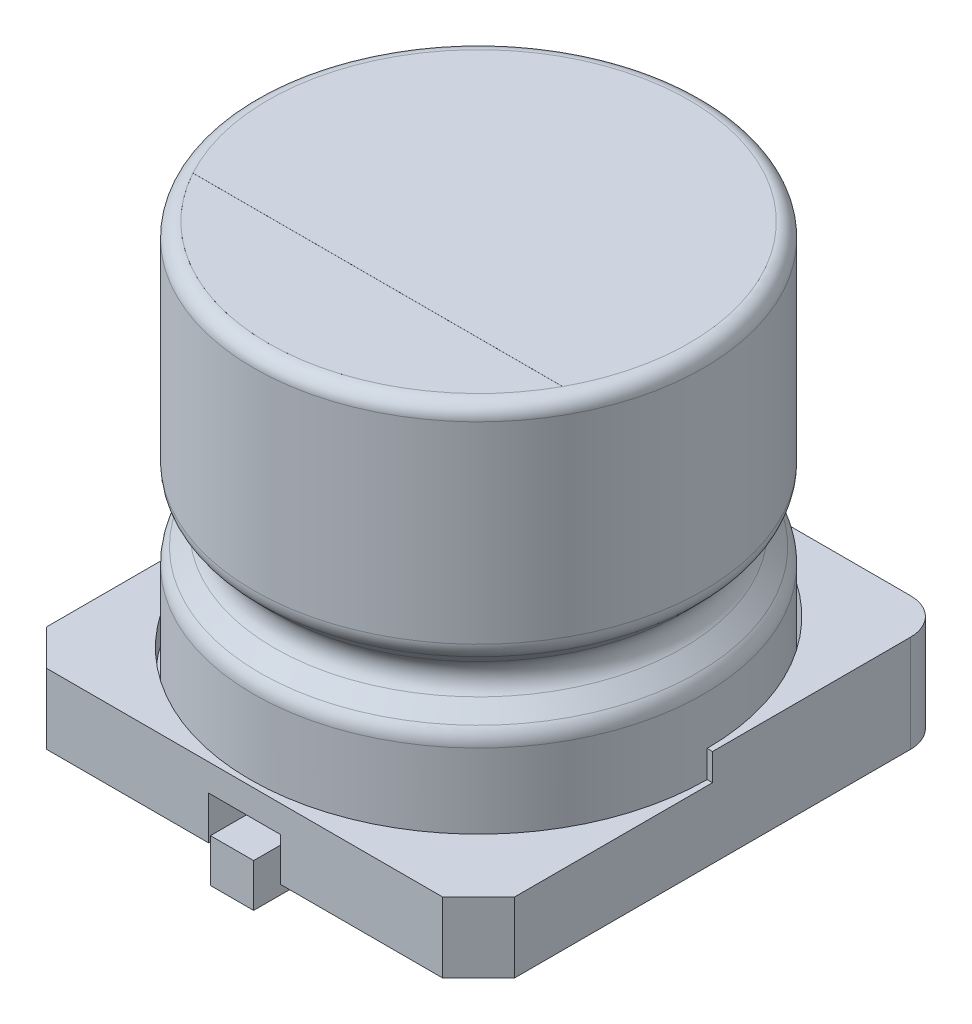
from build123d import *

# Parameters (mm, degrees)
EXTRUDE1_DEPTH     = 1.2
EXTRUDE2_START     = 1.5
SKETCH3_R          = 6.35
EXTRUDE2_DEPTH     = 1.5
EXTRUDE3_DEPTH     = 0.75
SKETCH5_R          = 0.75
EXTRUDE4_DEPTH     = 0.3
SKETCH7_W          = 1.2
SKETCH7_H          = 1.2
SCALE1_SCALE       = 0.5
CUT_EXTRUDE1_DEPTH = 0.001


with BuildPart() as part:
    # Sketch1 → Revolve1 (revolve)
    with BuildSketch(Plane.XY):
        with BuildLine():
            Line((0, 0), (-6.25, 0))
            Line((-6.25, 0), (-6.25, 2.751471863))
            ThreePointArc((-6.25, 2.751471863), (-6.20432772, 2.981081922), (-6.074264069, 3.175735931))
            Line((-6.074264069, 3.175735931), (-5.674264069, 3.575735931))
            ThreePointArc((-5.674264069, 3.575735931), (-5.498528137, 4), (-5.674264069, 4.424264069))
            Line((-5.674264069, 4.424264069), (-6.074264069, 4.824264069))
            ThreePointArc((-6.074264069, 4.824264069), (-6.20432772, 5.018918078), (-6.25, 5.248528137))
            Line((-6.25, 5.248528137), (-6.25, 10.6))
            ThreePointArc((-6.25, 10.6), (-6.132842712, 10.882842712), (-5.85, 11))
            Line((-5.85, 11), (0, 11))
            Line((0, 11), (0, 0))
        make_face()
    revolve(axis=Axis((0, 11, 0), (0, -1, 0)))

    # Sketch2 → Extrude1 (add)
    with BuildSketch(Plane.XZ):
        with BuildLine():
            Line((-6.5, 5.5), (-5.5, 6.5))
            Line((-5.5, 6.5), (-1, 6.5))
            Line((-1, 6.5), (-1, 1.6))
            Line((-1, 1.6), (1, 1.6))
            Line((1, 1.6), (1, 6.5))
            Line((1, 6.5), (5.5, 6.5))
            Line((5.5, 6.5), (6.5, 5.5))
            Line((6.5, 5.5), (6.5, -5.5))
            ThreePointArc((6.5, -5.5), (6.207106781, -6.207106781), (5.5, -6.5))
            Line((5.5, -6.5), (1, -6.5))
            Line((1, -6.5), (1, -1.6))
            Line((1, -1.6), (-1, -1.6))
            Line((-1, -1.6), (-1, -6.5))
            Line((-1, -6.5), (-5.5, -6.5))
            ThreePointArc((-5.5, -6.5), (-6.207106781, -6.207106781), (-6.5, -5.5))
            Line((-6.5, -5.5), (-6.5, 5.5))
        make_face()
    extrude(amount=EXTRUDE1_DEPTH)

    # Sketch3 → Extrude2 (add)
    with BuildSketch(Plane(origin=(0, 0, 0), x_dir=(1, 0, 0), z_dir=(0, 1, 0)).offset(EXTRUDE2_START)):
        with BuildLine():
            Line((5.5, -6.5), (-5.5, -6.5))
            Line((-5.5, -6.5), (-6.5, -5.5))
            Line((-6.5, -5.5), (-6.5, 5.5))
            ThreePointArc((-6.5, 5.5), (-6.207106781, 6.207106781), (-5.5, 6.5))
            Line((-5.5, 6.5), (5.5, 6.5))
            ThreePointArc((5.5, 6.5), (6.207106781, 6.207106781), (6.5, 5.5))
            Line((6.5, 5.5), (6.5, -5.5))
            Line((6.5, -5.5), (5.5, -6.5))
        make_face()
        Circle(SKETCH3_R, mode=Mode.SUBTRACT)
    extrude(amount=-EXTRUDE2_DEPTH)

    # Sketch4 → Extrude3 (cut)
    with BuildSketch(Plane(origin=(0, 1.5, 0), x_dir=(1, 0, 0), z_dir=(0, 1, 0))):
        with BuildLine():
            Line((-6.5, 0), (-6.35, 0))
            ThreePointArc((-6.35, 0), (0, -6.35), (6.35, 0))
            Line((6.35, 0), (6.5, 0))
            Line((6.5, 0), (6.5, -5.5))
            Line((6.5, -5.5), (5.5, -6.5))
            Line((5.5, -6.5), (-5.5, -6.5))
            Line((-5.5, -6.5), (-6.5, -5.5))
            Line((-6.5, -5.5), (-6.5, 0))
        make_face()
    extrude(amount=-EXTRUDE3_DEPTH, mode=Mode.SUBTRACT)

    # Sketch5 → Extrude4 (add)
    with BuildSketch(Plane.XZ.offset(1.2)):
        with Locations((-4, 4)):
            Circle(SKETCH5_R)
        with Locations((4, 4)):
            Circle(SKETCH5_R)
        with Locations((-4, -4)):
            Circle(SKETCH5_R)
        with Locations((4, -4)):
            Circle(SKETCH5_R)
    extrude(amount=EXTRUDE4_DEPTH)

    # Sweep1: sweep along a path in Sketch6
    with BuildLine(Plane(origin=(0, 0, 0), x_dir=(0, 0, -1), z_dir=(1, 0, 0))) as sweep1_path:
        Line((2.7, 0), (2.7, -0.05))
        ThreePointArc((2.7, -0.05), (3.051471863, -0.898528137), (3.9, -1.25))
        Line((3.9, -1.25), (6.85, -1.25))
    # Sketch7 → Sweep1 (sweep)
    with BuildSketch(Plane.XZ):
        with Locations((0, -2.7)):
            Rectangle(SKETCH7_W, SKETCH7_H)
    sweep1 = sweep(path=sweep1_path.line)

    # Mirror1: Sweep1 across plane
    add(sweep1.mirror(Plane.XY))


with BuildPart() as part_1:
    # Scale1: scaled about (0, 4.617982794, -0.053235297)
    add(part.part.scale(SCALE1_SCALE).moved(Location((0, 2.308991397, -0.026617649))))

    # Sketch8 → Cut-Extrude1 (cut)
    with BuildSketch(Plane(origin=(0, 7.808991397, 0), x_dir=(1, 0, 0), z_dir=(0, 1, 0))):
        with BuildLine():
            Line((-2.568194891, -1.373382352), (2.568194891, -1.373382352))
            ThreePointArc((2.568194891, -1.373382352), (0, -2.898382352), (-2.568194891, -1.373382352))
        make_face()
    extrude(amount=-CUT_EXTRUDE1_DEPTH, mode=Mode.SUBTRACT)


solid = part_1.part
